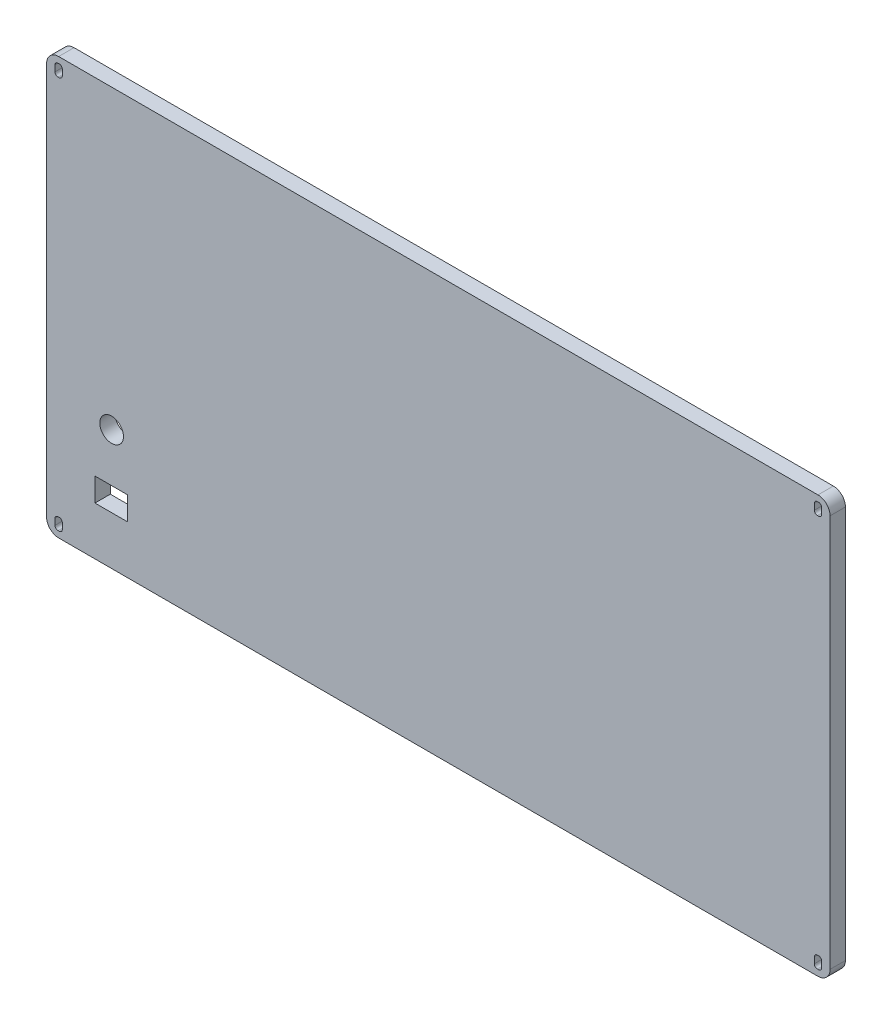
from build123d import *

# Parameters (mm, degrees)
SKETCH1_W           = 647.7
SKETCH1_H           = 344.678
SKETCH1_R           = 9.779
SKETCH1_W_2         = 27.1018
SKETCH1_H_2         = 19.3548
BOSS_EXTRUDE1_DEPTH = 12.7
FILLET1_R           = 10
FILLET2_R           = 10


with BuildPart() as part:
    # Sketch1 → Boss-Extrude1 (new body)
    with BuildSketch(Plane.XY):
        with Locations((25.51036036, -39.985171171)):
            Rectangle(SKETCH1_W, SKETCH1_H)
        with Locations((-244.559967776, -112.969371171)):
            Circle(SKETCH1_R, mode=Mode.SUBTRACT)
        with BuildLine():
            Line((339.86036036, -207.324171171), (338.86036036, -207.324171171))
            ThreePointArc((338.86036036, -207.324171171), (337.092593407, -206.591938124), (336.36036036, -204.824171171))
            Line((336.36036036, -204.824171171), (336.36036036, -199.824171171))
            ThreePointArc((336.36036036, -199.824171171), (337.092593407, -198.056404218), (338.86036036, -197.324171171))
            Line((338.86036036, -197.324171171), (339.86036036, -197.324171171))
            ThreePointArc((339.86036036, -197.324171171), (341.628127313, -198.056404218), (342.36036036, -199.824171171))
            Line((342.36036036, -199.824171171), (342.36036036, -204.824171171))
            ThreePointArc((342.36036036, -204.824171171), (341.628127313, -206.591938124), (339.86036036, -207.324171171))
        make_face(mode=Mode.SUBTRACT)
        with BuildLine():
            Line((-287.83963964, -207.324171171), (-288.83963964, -207.324171171))
            ThreePointArc((-288.83963964, -207.324171171), (-290.607406593, -206.591938124), (-291.33963964, -204.824171171))
            Line((-291.33963964, -204.824171171), (-291.33963964, -199.824171171))
            ThreePointArc((-291.33963964, -199.824171171), (-290.607406593, -198.056404218), (-288.83963964, -197.324171171))
            Line((-288.83963964, -197.324171171), (-287.83963964, -197.324171171))
            ThreePointArc((-287.83963964, -197.324171171), (-286.071872687, -198.056404218), (-285.33963964, -199.824171171))
            Line((-285.33963964, -199.824171171), (-285.33963964, -204.824171171))
            ThreePointArc((-285.33963964, -204.824171171), (-286.071872687, -206.591938124), (-287.83963964, -207.324171171))
        make_face(mode=Mode.SUBTRACT)
        with BuildLine():
            Line((-287.83963964, 117.355828829), (-288.83963964, 117.355828829))
            ThreePointArc((-288.83963964, 117.355828829), (-290.607406593, 118.088061876), (-291.33963964, 119.855828829))
            Line((-291.33963964, 119.855828829), (-291.33963964, 124.855828829))
            ThreePointArc((-291.33963964, 124.855828829), (-290.607406593, 126.623595782), (-288.83963964, 127.355828829))
            Line((-288.83963964, 127.355828829), (-287.83963964, 127.355828829))
            ThreePointArc((-287.83963964, 127.355828829), (-286.071872687, 126.623595782), (-285.33963964, 124.855828829))
            Line((-285.33963964, 124.855828829), (-285.33963964, 119.855828829))
            ThreePointArc((-285.33963964, 119.855828829), (-286.071872687, 118.088061876), (-287.83963964, 117.355828829))
        make_face(mode=Mode.SUBTRACT)
        with BuildLine():
            Line((339.86036036, 117.355828829), (338.86036036, 117.355828829))
            ThreePointArc((338.86036036, 117.355828829), (337.092593407, 118.088061876), (336.36036036, 119.855828829))
            Line((336.36036036, 119.855828829), (336.36036036, 124.855828829))
            ThreePointArc((336.36036036, 124.855828829), (337.092593407, 126.623595782), (338.86036036, 127.355828829))
            Line((338.86036036, 127.355828829), (339.86036036, 127.355828829))
            ThreePointArc((339.86036036, 127.355828829), (341.628127313, 126.623595782), (342.36036036, 124.855828829))
            Line((342.36036036, 124.855828829), (342.36036036, 119.855828829))
            ThreePointArc((342.36036036, 119.855828829), (341.628127313, 118.088061876), (339.86036036, 117.355828829))
        make_face(mode=Mode.SUBTRACT)
        with Locations((-244.78873964, -162.646771171)):
            Rectangle(SKETCH1_W_2, SKETCH1_H_2, mode=Mode.SUBTRACT)
    extrude(amount=BOSS_EXTRUDE1_DEPTH)

    # Fillet1
    fillet1_edges = [part.edges().sort_by_distance(p)[0] for p in [
        (349.36036036, -212.324171171, 6.35),
        (349.36036036, 132.353828829, 6.35),
        (-298.33963964, 132.353828829, 6.35),
    ]]
    fillet(fillet1_edges, radius=FILLET1_R)

    # Fillet2
    fillet2_edges = [part.edges().sort_by_distance(p)[0] for p in [
        (-298.33963964, -212.324171171, 6.35),
    ]]
    fillet(fillet2_edges, radius=FILLET2_R)


solid = part.part
